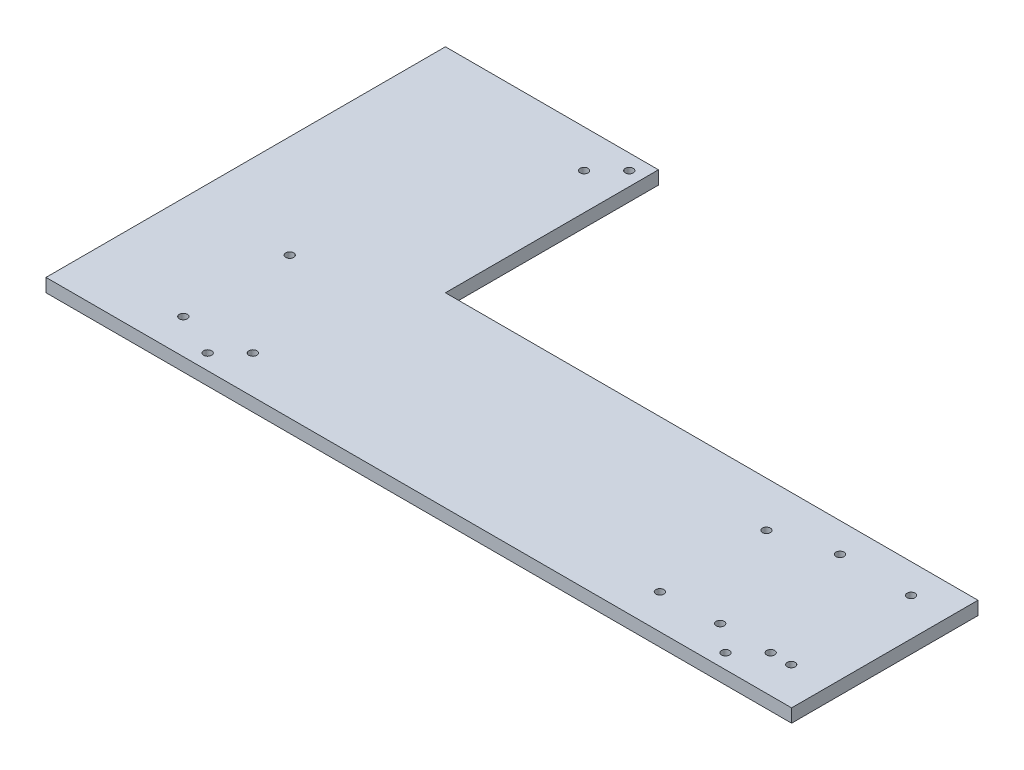
from build123d import *

# Parameters (mm, degrees)
SKETCH1_R           = 1.5
BOSS_EXTRUDE1_DEPTH = 5


with BuildPart() as part:
    # Sketch1 → Boss-Extrude1 (new body)
    with BuildSketch(Plane(origin=(0, 0, 0), x_dir=(1, 0, 0), z_dir=(0, 1, 0))):
        Polygon((-124.555160142, -60.782918149), (155.444839858, -60.782918149), (155.444839858, 9.217081851), (-44.555160142, 9.217081851), (-44.555160142, 89.217081851), (-124.555160142, 89.217081851), align=None)
        with Locations((-69.609979708, -55.025558837)):
            Circle(SKETCH1_R, mode=Mode.SUBTRACT)
        with Locations((-86.021964222, -47.738383023)):
            Circle(SKETCH1_R, mode=Mode.SUBTRACT)
        with Locations((-61.124698334, -46.540277462)):
            Circle(SKETCH1_R, mode=Mode.SUBTRACT)
        with Locations((-86.021964222, -7.782918149)):
            Circle(SKETCH1_R, mode=Mode.SUBTRACT)
        with Locations((92.978035778, -47.782918149)):
            Circle(SKETCH1_R, mode=Mode.SUBTRACT)
        with Locations((114.620218271, -46.782918149)):
            Circle(SKETCH1_R, mode=Mode.SUBTRACT)
        with Locations((125.096363889, -55.261198979)):
            Circle(SKETCH1_R, mode=Mode.SUBTRACT)
        with Locations((133.581645264, -46.775917605)):
            Circle(SKETCH1_R, mode=Mode.SUBTRACT)
        with Locations((141.300092758, -46.782918149)):
            Circle(SKETCH1_R, mode=Mode.SUBTRACT)
        with Locations((92.978035778, -7.782918149)):
            Circle(SKETCH1_R, mode=Mode.SUBTRACT)
        with Locations((114.620218271, -1.782918149)):
            Circle(SKETCH1_R, mode=Mode.SUBTRACT)
        with Locations((141.300092758, -1.782918149)):
            Circle(SKETCH1_R, mode=Mode.SUBTRACT)
        with Locations((-49.752255096, 83.459722538)):
            Circle(SKETCH1_R, mode=Mode.SUBTRACT)
        with Locations((-58.23753647, 74.974441163)):
            Circle(SKETCH1_R, mode=Mode.SUBTRACT)
    extrude(amount=BOSS_EXTRUDE1_DEPTH)


solid = part.part
